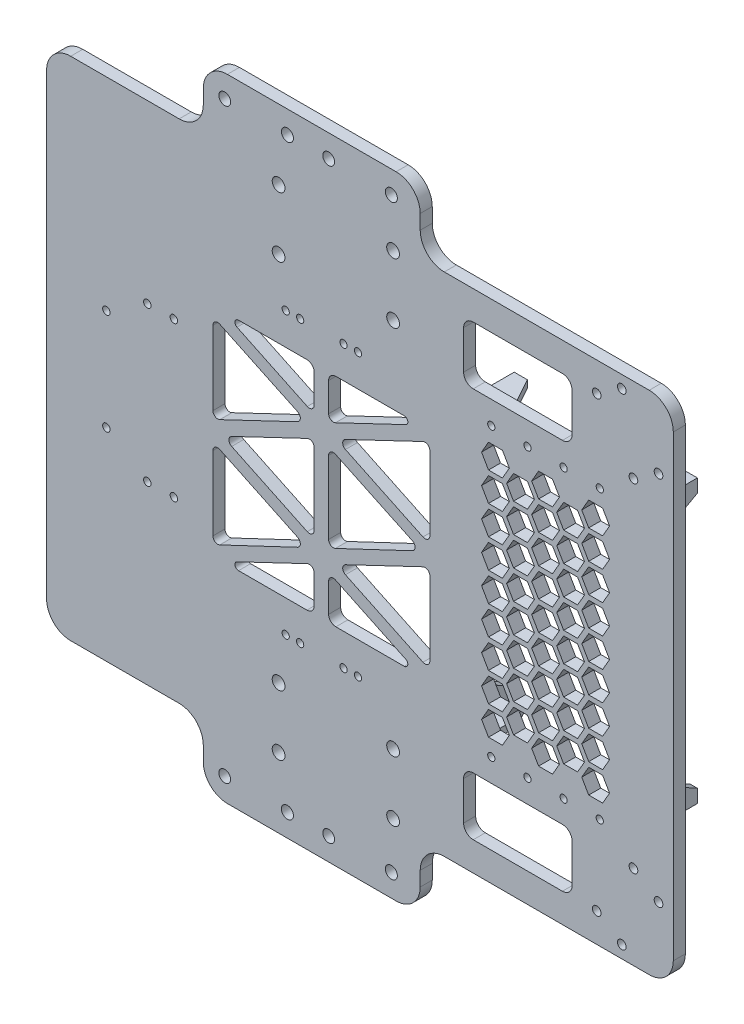
from build123d import *

# Parameters (mm, degrees)
EXTRUDE_1_DEPTH       = 5
EXTRUDE_2_DEPTH       = 20
CUT_EXTRUDE_3_DEPTH   = 10
CUT_EXTRUDE_4_DEPTH   = 10
MIRROR_2_COPY_1_DEPTH = 20
MIRROR_2_COPY_2_DEPTH = 10
MIRROR_2_COPY_3_DEPTH = 10
MIRROR_2_COPY_4_DEPTH = 20
MIRROR_2_COPY_5_DEPTH = 10
MIRROR_2_COPY_6_DEPTH = 10
CUT_EXTRUDE_5_DEPTH   = 5
SKETCH_9_W            = 45
SKETCH_9_H            = 24
CUT_EXTRUDE_6_DEPTH   = 5
FILLET_1_R            = 4
FILLET_2_R            = 1.5
FILLET_3_R            = 2
FILLET_4_R            = 3
SKETCH_10_R           = 1.8
SKETCH_10_R_2         = 1.55
SKETCH_10_R_3         = 2.65
SKETCH_10_R_4         = 2.5
SKETCH_10_R_5         = 2.45
SKETCH_10_R_6         = 1.5
CUT_EXTRUDE_7_DEPTH   = 186.636742053


with BuildPart() as part:
    # 草图1 → 凸台-拉伸1 (new body)
    with BuildSketch(Plane.XY):
        with BuildLine():
            Line((-130, 95), (-130, -95))
            ThreePointArc((-130, -95), (-127.071067812, -102.071067812), (-120, -105))
            Line((-120, -105), (-75, -105))
            ThreePointArc((-75, -105), (-67.928932188, -107.928932188), (-65, -115))
            Line((-65, -115), (-65, -121))
            ThreePointArc((-65, -121), (-62.071067812, -128.071067812), (-55, -131))
            Line((-55, -131), (15, -131))
            ThreePointArc((15, -131), (22.071067812, -128.071067812), (25, -121))
            Line((25, -121), (25, -115))
            ThreePointArc((25, -115), (27.928932188, -107.928932188), (35, -105))
            Line((35, -105), (120, -105))
            ThreePointArc((120, -105), (127.071067812, -102.071067812), (130, -95))
            Line((130, -95), (130, 95))
            ThreePointArc((130, 95), (127.071067812, 102.071067812), (120, 105))
            Line((120, 105), (35, 105))
            ThreePointArc((35, 105), (27.928932188, 107.928932188), (25, 115))
            Line((25, 115), (25, 121))
            ThreePointArc((25, 121), (22.071067812, 128.071067812), (15, 131))
            Line((15, 131), (-55, 131))
            ThreePointArc((-55, 131), (-62.071067812, 128.071067812), (-65, 121))
            Line((-65, 121), (-65, 115))
            ThreePointArc((-65, 115), (-67.928932188, 107.928932188), (-75, 105))
            Line((-75, 105), (-120, 105))
            ThreePointArc((-120, 105), (-127.071067812, 102.071067812), (-130, 95))
        make_face()
    extrude(amount=EXTRUDE_1_DEPTH)

    # 草图4 → 凸台-拉伸2 (add)
    with BuildSketch(Plane(origin=(0, 0, 0), x_dir=(-1, 0, 0), z_dir=(0, 0, -1))):
        Polygon((-39, -47.5), (-39, -58.5), (-50, -58.5), (-50, -55.5), (-42, -55.5), (-42, -47.5), align=None)
    extrude_2 = extrude(amount=EXTRUDE_2_DEPTH)

    # 草图5 → 切除-拉伸3 (cut)
    with BuildSketch(Plane.XZ.offset(58.5)):
        Polygon((50, -10), (44.5, -20), (50, -20), align=None)
    cut_extrude_3 = extrude(amount=-CUT_EXTRUDE_3_DEPTH, mode=Mode.SUBTRACT)

    # 草图6 → 切除-拉伸4 (cut)
    with BuildSketch(Plane.ZY.offset(-39)):
        Polygon((-20, -53), (-10, -47.5), (-20, -47.5), align=None)
    cut_extrude_4 = extrude(amount=-CUT_EXTRUDE_4_DEPTH, mode=Mode.SUBTRACT)

    # 镜向1: 凸台-拉伸2, 切除-拉伸3, 切除-拉伸4 across plane
    add(extrude_2.mirror(Plane(origin=(77, 0, 0), x_dir=(0, 0, 1), z_dir=(1, 0, 0))))
    add(cut_extrude_3.mirror(Plane(origin=(77, 0, 0), x_dir=(0, 0, 1), z_dir=(1, 0, 0))), mode=Mode.SUBTRACT)
    add(cut_extrude_4.mirror(Plane(origin=(77, 0, 0), x_dir=(0, 0, 1), z_dir=(1, 0, 0))), mode=Mode.SUBTRACT)

    # 镜向2 copy 1 sketch → 镜向2 copy 1 (add)
    with BuildSketch(Plane(origin=(154, 0, 0), x_dir=(1, 0, 0), z_dir=(0, 0, -1))):
        Polygon((-39, -47.5), (-39, -58.5), (-50, -58.5), (-50, -55.5), (-42, -55.5), (-42, -47.5), align=None)
    extrude(amount=MIRROR_2_COPY_1_DEPTH)

    # 镜向2 copy 2 sketch → 镜向2 copy 2 (cut)
    with BuildSketch(Plane(origin=(154, 58.5, 0), x_dir=(-1, 0, 0), z_dir=(0, 1, 0))):
        Polygon((50, -10), (44.5, -20), (50, -20), align=None)
    extrude(amount=-MIRROR_2_COPY_2_DEPTH, mode=Mode.SUBTRACT)

    # 镜向2 copy 3 sketch → 镜向2 copy 3 (cut)
    with BuildSketch(Plane(origin=(115, 0, 0), x_dir=(0, 0, 1), z_dir=(1, 0, 0))):
        Polygon((-20, -53), (-10, -47.5), (-20, -47.5), align=None)
    extrude(amount=-MIRROR_2_COPY_3_DEPTH, mode=Mode.SUBTRACT)

    # 镜向2 copy 4 sketch → 镜向2 copy 4 (add)
    with BuildSketch(Plane(origin=(0, 0, 0), x_dir=(-1, 0, 0), z_dir=(0, 0, -1))):
        Polygon((-39, 47.5), (-39, 58.5), (-50, 58.5), (-50, 55.5), (-42, 55.5), (-42, 47.5), align=None)
    extrude(amount=MIRROR_2_COPY_4_DEPTH)

    # 镜向2 copy 5 sketch → 镜向2 copy 5 (cut)
    with BuildSketch(Plane(origin=(0, 58.5, 0), x_dir=(1, 0, 0), z_dir=(0, 1, 0))):
        Polygon((50, 10), (44.5, 20), (50, 20), align=None)
    extrude(amount=-MIRROR_2_COPY_5_DEPTH, mode=Mode.SUBTRACT)

    # 镜向2 copy 6 sketch → 镜向2 copy 6 (cut)
    with BuildSketch(Plane.ZY.offset(-39)):
        Polygon((-20, 53), (-10, 47.5), (-20, 47.5), align=None)
    extrude(amount=-MIRROR_2_COPY_6_DEPTH, mode=Mode.SUBTRACT)

    # 草图7 → 切除-拉伸5 (cut)
    with BuildSketch(Plane(origin=(0, 0, 0), x_dir=(-1, 0, 0), z_dir=(0, 0, -1))):
        Polygon((-92.012994616, 36), (-94.899745962, 41), (-100.673248654, 41), (-103.56, 36), (-100.673248654, 31), (-94.899745962, 31), align=None)
        Polygon((-74.115136271, 31), (-71.228384925, 36), (-74.115136271, 41), (-79.888638963, 41), (-82.775390309, 36), (-79.888638963, 31), align=None)
        Polygon((-92.012994616, 24), (-94.899745962, 29), (-100.673248654, 29), (-103.56, 24), (-100.673248654, 19), (-94.899745962, 19), align=None)
        Polygon((-93.167695155, 30), (-90.280943809, 25), (-84.507441117, 25), (-81.620689771, 30), (-84.507441117, 35), (-90.280943809, 35), align=None)
        Polygon((-84.507441117, 37), (-81.620689771, 42), (-84.507441117, 47), (-90.280943809, 47), (-93.167695155, 42), (-90.280943809, 37), align=None)
        Polygon((-79.888638963, 43), (-74.115136271, 43), (-71.228384925, 48), (-74.115136271, 53), (-79.888638963, 53), (-82.775390309, 48), align=None)
        Polygon((-94.899745962, 43), (-92.012994616, 48), (-94.899745962, 53), (-100.673248654, 53), (-103.56, 48), (-100.673248654, 43), align=None)
        Polygon((-72.383085464, 42), (-69.496334118, 37), (-63.722831426, 37), (-60.83608008, 42), (-63.722831426, 47), (-69.496334118, 47), align=None)
        Polygon((-93.167695155, 18), (-90.280943809, 13), (-84.507441117, 13), (-81.620689771, 18), (-84.507441117, 23), (-90.280943809, 23), align=None)
        Polygon((-74.115136271, 19), (-71.228384925, 24), (-74.115136271, 29), (-79.888638963, 29), (-82.775390309, 24), (-79.888638963, 19), align=None)
        Polygon((-72.383085464, 30), (-69.496334118, 25), (-63.722831426, 25), (-60.83608008, 30), (-63.722831426, 35), (-69.496334118, 35), align=None)
        Polygon((-92.012994616, 12), (-94.899745962, 17), (-100.673248654, 17), (-103.56, 12), (-100.673248654, 7), (-94.899745962, 7), align=None)
        Polygon((-93.167695155, 6), (-90.280943809, 1), (-84.507441117, 1), (-81.620689771, 6), (-84.507441117, 11), (-90.280943809, 11), align=None)
        Polygon((-74.115136271, 7), (-71.228384925, 12), (-74.115136271, 17), (-79.888638963, 17), (-82.775390309, 12), (-79.888638963, 7), align=None)
        Polygon((-72.383085464, 18), (-69.496334118, 13), (-63.722831426, 13), (-60.83608008, 18), (-63.722831426, 23), (-69.496334118, 23), align=None)
        Polygon((-92.012994616, 0), (-94.899745962, 5), (-100.673248654, 5), (-103.56, 0), (-100.673248654, -5), (-94.899745962, -5), align=None)
        Polygon((-93.167695155, -6), (-90.280943809, -11), (-84.507441117, -11), (-81.620689771, -6), (-84.507441117, -1), (-90.280943809, -1), align=None)
        Polygon((-74.115136271, -5), (-71.228384925, 0), (-74.115136271, 5), (-79.888638963, 5), (-82.775390309, 0), (-79.888638963, -5), align=None)
        Polygon((-72.383085464, 6), (-69.496334118, 1), (-63.722831426, 1), (-60.83608008, 6), (-63.722831426, 11), (-69.496334118, 11), align=None)
        Polygon((-92.012994616, -12), (-94.899745962, -7), (-100.673248654, -7), (-103.56, -12), (-100.673248654, -17), (-94.899745962, -17), align=None)
        Polygon((-93.167695155, -18), (-90.280943809, -23), (-84.507441117, -23), (-81.620689771, -18), (-84.507441117, -13), (-90.280943809, -13), align=None)
        Polygon((-74.115136271, -17), (-71.228384925, -12), (-74.115136271, -7), (-79.888638963, -7), (-82.775390309, -12), (-79.888638963, -17), align=None)
        Polygon((-72.383085464, -6), (-69.496334118, -11), (-63.722831426, -11), (-60.83608008, -6), (-63.722831426, -1), (-69.496334118, -1), align=None)
        Polygon((-92.012994616, -24), (-94.899745962, -19), (-100.673248654, -19), (-103.56, -24), (-100.673248654, -29), (-94.899745962, -29), align=None)
        Polygon((-93.167695155, -30), (-90.280943809, -35), (-84.507441117, -35), (-81.620689771, -30), (-84.507441117, -25), (-90.280943809, -25), align=None)
        Polygon((-74.115136271, -29), (-71.228384925, -24), (-74.115136271, -19), (-79.888638963, -19), (-82.775390309, -24), (-79.888638963, -29), align=None)
        Polygon((-72.383085464, -18), (-69.496334118, -23), (-63.722831426, -23), (-60.83608008, -18), (-63.722831426, -13), (-69.496334118, -13), align=None)
        Polygon((-92.012994616, -36), (-94.899745962, -31), (-100.673248654, -31), (-103.56, -36), (-100.673248654, -41), (-94.899745962, -41), align=None)
        Polygon((-93.167695155, -42), (-90.280943809, -47), (-84.507441117, -47), (-81.620689771, -42), (-84.507441117, -37), (-90.280943809, -37), align=None)
        Polygon((-74.115136271, -41), (-71.228384925, -36), (-74.115136271, -31), (-79.888638963, -31), (-82.775390309, -36), (-79.888638963, -41), align=None)
        Polygon((-72.383085464, -30), (-69.496334118, -35), (-63.722831426, -35), (-60.83608008, -30), (-63.722831426, -25), (-69.496334118, -25), align=None)
        Polygon((-92.012994616, -48), (-94.899745962, -43), (-100.673248654, -43), (-103.56, -48), (-100.673248654, -53), (-94.899745962, -53), align=None)
        Polygon((-74.115136271, -53), (-71.228384925, -48), (-74.115136271, -43), (-79.888638963, -43), (-82.775390309, -48), (-79.888638963, -53), align=None)
        Polygon((-72.383085464, -42), (-69.496334118, -47), (-63.722831426, -47), (-60.83608008, -42), (-63.722831426, -37), (-69.496334118, -37), align=None)
        Polygon((-61.990780618, 36), (-59.104029272, 31), (-53.330526581, 31), (-50.443775235, 36), (-53.330526581, 41), (-59.104029272, 41), align=None)
        Polygon((-61.990780618, 48), (-59.104029272, 43), (-53.330526581, 43), (-50.443775235, 48), (-53.330526581, 53), (-59.104029272, 53), align=None)
        Polygon((-61.990780618, 24), (-59.104029272, 19), (-53.330526581, 19), (-50.443775235, 24), (-53.330526581, 29), (-59.104029272, 29), align=None)
        Polygon((-61.990780618, 12), (-59.104029272, 7), (-53.330526581, 7), (-50.443775235, 12), (-53.330526581, 17), (-59.104029272, 17), align=None)
        Polygon((-61.990780618, 0), (-59.104029272, -5), (-53.330526581, -5), (-50.443775235, 0), (-53.330526581, 5), (-59.104029272, 5), align=None)
        Polygon((-61.990780618, -12), (-59.104029272, -17), (-53.330526581, -17), (-50.443775235, -12), (-53.330526581, -7), (-59.104029272, -7), align=None)
        Polygon((-61.990780618, -24), (-59.104029272, -29), (-53.330526581, -29), (-50.443775235, -24), (-53.330526581, -19), (-59.104029272, -19), align=None)
        Polygon((-61.990780618, -36), (-59.104029272, -41), (-53.330526581, -41), (-50.443775235, -36), (-53.330526581, -31), (-59.104029272, -31), align=None)
        Polygon((-61.990780618, -48), (-59.104029272, -53), (-53.330526581, -53), (-50.443775235, -48), (-53.330526581, -43), (-59.104029272, -43), align=None)
    extrude(amount=-CUT_EXTRUDE_5_DEPTH, mode=Mode.SUBTRACT)

    # 草图9 → 切除-拉伸6 (cut)
    with BuildSketch(Plane(origin=(0, 0, 0), x_dir=(-1, 0, 0), z_dir=(0, 0, -1))):
        Polygon((9.804878049, 22.5), (-29, 41), (-29, 4), align=None)
        Polygon((13, -26.88372093), (-25, -45), (13, -45), align=None)
        Polygon((22.074593576, -22.557461202), (61, -41), (61, -4), align=None)
        Polygon((19, 26.88372093), (57, 45), (19, 45), align=None)
        Polygon((19, -18.11627907), (57, 0), (19, 18.11627907), align=None)
        with Locations((-65.5, 81)):
            Rectangle(SKETCH_9_W, SKETCH_9_H)
        with Locations((-65.5, -81)):
            Rectangle(SKETCH_9_W, SKETCH_9_H)
        Polygon((13, 45), (-25, 45), (13, 26.88372093), align=None)
        Polygon((61, 4), (61, 41), (22.074593576, 22.557461202), align=None)
        Polygon((13, 18.257993079), (-25.535898385, 0), (13, -18.257993079), align=None)
        Polygon((19, -45), (57, -45), (19, -26.88372093), align=None)
        Polygon((-29, -41), (9.804878049, -22.5), (-29, -4), align=None)
    extrude(amount=-CUT_EXTRUDE_6_DEPTH, mode=Mode.SUBTRACT)

    # 圆角1
    fillet_1_edges = [part.edges().sort_by_distance(p)[0] for p in [
        (43, -93, 2.5),
        (88, -69, 2.5),
        (43, -69, 2.5),
        (88, -93, 2.5),
        (88, 69, 2.5),
        (43, 69, 2.5),
        (43, 93, 2.5),
        (88, 93, 2.5),
    ]]
    fillet(fillet_1_edges, radius=FILLET_1_R)

    # 圆角2
    fillet_2_edges = [part.edges().sort_by_distance(p)[0] for p in [
        (25, -45, 2.5),
        (-57, -45, 2.5),
        (25, 45, 2.5),
        (-57, 45, 2.5),
    ]]
    fillet(fillet_2_edges, radius=FILLET_2_R)

    # 圆角3
    fillet_3_edges = [part.edges().sort_by_distance(p)[0] for p in [
        (29, -4, 2.5),
        (29, 4, 2.5),
        (-13, -18.257993079, 2.5),
        (-61, -41, 2.5),
        (-61, 4, 2.5),
        (-13, -26.88372093, 2.5),
        (-13, 18.257993079, 2.5),
        (-61, -4, 2.5),
        (-22.074593576, -22.557461202, 2.5),
        (25.535898385, 0, 2.5),
        (-22.074593576, 22.557461202, 2.5),
        (-61, 41, 2.5),
        (-19, 26.88372093, 2.5),
        (-19, -26.88372093, 2.5),
        (-19, -18.11627907, 2.5),
        (29, -41, 2.5),
        (29, 41, 2.5),
        (-57, 0, 2.5),
        (-9.804878049, -22.5, 2.5),
        (-13, 26.88372093, 2.5),
        (-9.804878049, 22.5, 2.5),
        (-19, 18.11627907, 2.5),
    ]]
    fillet(fillet_3_edges, radius=FILLET_3_R)

    # 圆角4
    fillet_4_edges = [part.edges().sort_by_distance(p)[0] for p in [
        (-13, -45, 2.5),
        (-13, 45, 2.5),
        (-19, -45, 2.5),
        (-19, 45, 2.5),
    ]]
    fillet(fillet_4_edges, radius=FILLET_4_R)

    # 草图10 → 切除-拉伸7 (cut, through all)
    with BuildSketch(Plane(origin=(0, 0, 0), x_dir=(-1, 0, 0), z_dir=(0, 0, -1))):
        with Locations((-123.874270778, 76.959685144)):
            Circle(SKETCH_10_R)
        with Locations((-113.46869275, 70.033362462)):
            Circle(SKETCH_10_R)
        with Locations((-108.636360878, 99.851956806)):
            Circle(SKETCH_10_R)
        with Locations((-98.23078285, 92.925634125)):
            Circle(SKETCH_10_R)
        with Locations((105.210066138, 21)):
            Circle(SKETCH_10_R_2)
        with Locations((88.210066138, 32)):
            Circle(SKETCH_10_R_2)
        with Locations((77.210066138, 32)):
            Circle(SKETCH_10_R_2)
        with Locations((33.75, 102)):
            Circle(SKETCH_10_R_3)
        with Locations((33.75, 77)):
            Circle(SKETCH_10_R_3)
        with Locations((-13.75, 77)):
            Circle(SKETCH_10_R_3)
        with Locations((-13.75, 102)):
            Circle(SKETCH_10_R_3)
        with Locations((-13.026746603, 121.678975654)):
            Circle(SKETCH_10_R_4)
        with Locations((56.094087389, 121.678975654)):
            Circle(SKETCH_10_R_5)
        with Locations((30.094087389, 121.678975654)):
            Circle(SKETCH_10_R_4)
        with Locations((12.973253397, 121.678975654)):
            Circle(SKETCH_10_R_5)
        with Locations((12.973253397, -121.678975654)):
            Circle(SKETCH_10_R_5)
        with Locations((30.094087389, -121.678975654)):
            Circle(SKETCH_10_R_4)
        with Locations((56.094087389, -121.678975654)):
            Circle(SKETCH_10_R_5)
        with Locations((-13.026746603, -121.678975654)):
            Circle(SKETCH_10_R_4)
        with Locations((-13.75, -102)):
            Circle(SKETCH_10_R_3)
        with Locations((-13.75, -77)):
            Circle(SKETCH_10_R_3)
        with Locations((33.75, -77)):
            Circle(SKETCH_10_R_3)
        with Locations((33.75, -102)):
            Circle(SKETCH_10_R_3)
        with Locations((77.210066138, -32)):
            Circle(SKETCH_10_R_2)
        with Locations((88.210066138, -32)):
            Circle(SKETCH_10_R_2)
        with Locations((105.210066138, -21)):
            Circle(SKETCH_10_R_2)
        with Locations((-98.23078285, -92.925634125)):
            Circle(SKETCH_10_R)
        with Locations((-108.636360878, -99.851956806)):
            Circle(SKETCH_10_R)
        with Locations((-113.46869275, -70.033362462)):
            Circle(SKETCH_10_R)
        with Locations((-123.874270778, -76.959685144)):
            Circle(SKETCH_10_R)
        with Locations((-99.5, 59.5)):
            Circle(SKETCH_10_R_6)
        with Locations((-84.5, 59.5)):
            Circle(SKETCH_10_R_6)
        with Locations((-69.5, 59.5)):
            Circle(SKETCH_10_R_6)
        with Locations((-54.5, 59.5)):
            Circle(SKETCH_10_R_6)
        with Locations((0.806057342, 58.25)):
            Circle(SKETCH_10_R_6)
        with Locations((6.806057342, 58.25)):
            Circle(SKETCH_10_R_6)
        with Locations((24.806057342, 58.25)):
            Circle(SKETCH_10_R_6)
        with Locations((30.806057342, 58.25)):
            Circle(SKETCH_10_R_6)
        with Locations((30.806057342, -58.25)):
            Circle(SKETCH_10_R_6)
        with Locations((24.806057342, -58.25)):
            Circle(SKETCH_10_R_6)
        with Locations((6.806057342, -58.25)):
            Circle(SKETCH_10_R_6)
        with Locations((0.806057342, -58.25)):
            Circle(SKETCH_10_R_6)
        with Locations((-54.5, -59.5)):
            Circle(SKETCH_10_R_6)
        with Locations((-69.5, -59.5)):
            Circle(SKETCH_10_R_6)
        with Locations((-84.5, -59.5)):
            Circle(SKETCH_10_R_6)
        with Locations((-99.5, -59.5)):
            Circle(SKETCH_10_R_6)
    extrude(amount=-CUT_EXTRUDE_7_DEPTH, mode=Mode.SUBTRACT)


solid = part.part
